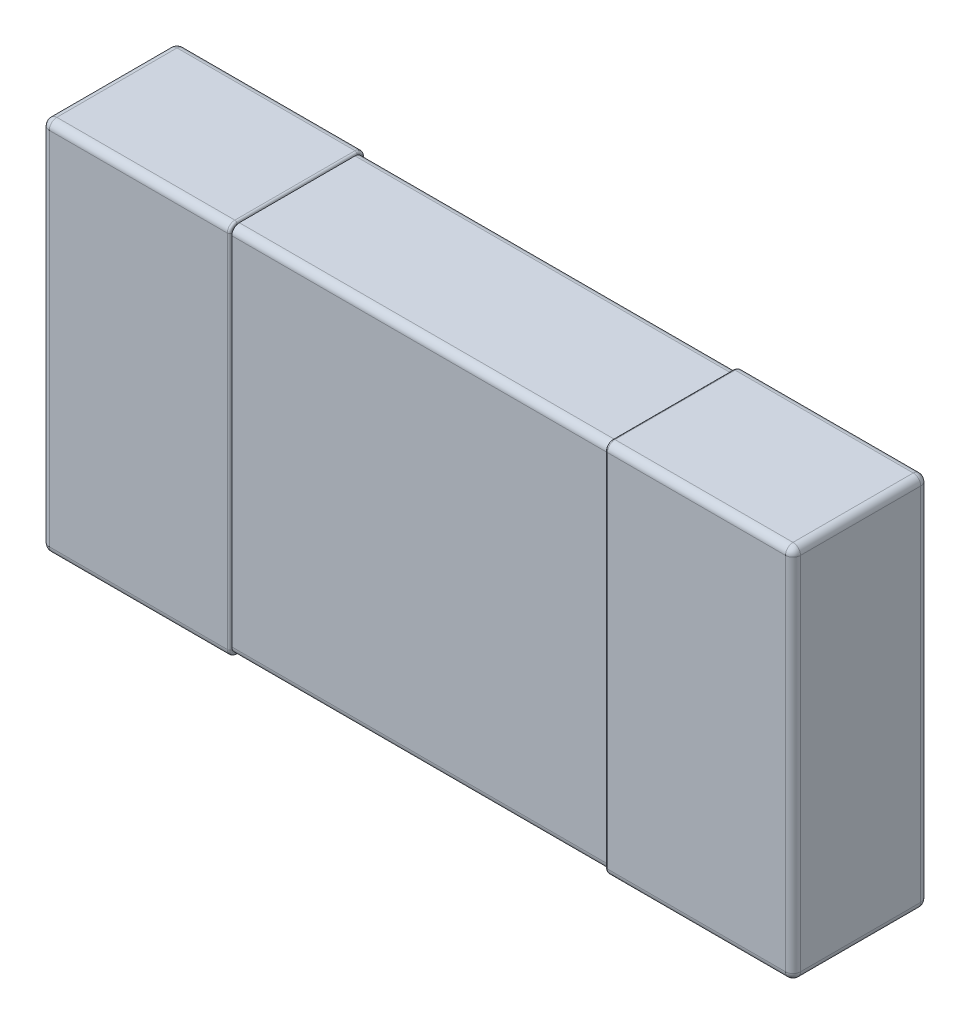
from build123d import *

# Parameters (mm, degrees)
SKETCH1_W                           = 1
SKETCH1_H                           = 0.5
ALL_BODY_DEPTH                      = 0.18
CUT_OUT_THE_BODY_FOR_PIN_DEPTH      = 0.25
CUT_OUT_THE_BODY_FOR_PIN_DEPTH_BACK = 0.25
SKETCH2_OUTSIDE_W                   = 2.406
SKETCH2_OUTSIDE_H                   = 2.726
SKETCH2_OUTSIDE_W_2                 = 0.174
SKETCH2_OUTSIDE_H_2                 = 0.494
BODY_FILLET_R                       = 0.01
PIN_FILLET_A_R                      = 0.01
PIN_FILLET_B_R                      = 0.003


with BuildPart() as part:
    # Sketch1 → All body (new body)
    with BuildSketch(Plane.XY):
        Rectangle(SKETCH1_W, SKETCH1_H)
    extrude(amount=ALL_BODY_DEPTH)

    # Sketch2 outside → Cut out the body for pin (cut, two sides: drawn at the far end of the back side and taken through both)
    with BuildSketch(Plane(origin=(0, 0, 0), x_dir=(0, 0, -1), z_dir=(1, 0, 0)).offset(-CUT_OUT_THE_BODY_FOR_PIN_DEPTH_BACK)):
        with Locations((-0.09, 0)):
            Rectangle(SKETCH2_OUTSIDE_W, SKETCH2_OUTSIDE_H)
        with Locations((-0.09, 0)):
            Rectangle(SKETCH2_OUTSIDE_W_2, SKETCH2_OUTSIDE_H_2, mode=Mode.SUBTRACT)
    extrude(amount=CUT_OUT_THE_BODY_FOR_PIN_DEPTH + CUT_OUT_THE_BODY_FOR_PIN_DEPTH_BACK, mode=Mode.SUBTRACT)

    # Body fillet
    body_fillet_edges = [part.edges().sort_by_distance(p)[0] for p in [
        (0, 0.247, 0.003),
        (0, 0.247, 0.177),
        (0, -0.247, 0.177),
        (0, -0.247, 0.003),
    ]]
    fillet(body_fillet_edges, radius=BODY_FILLET_R)

    # Pin fillet a
    pin_fillet_a_edges = [part.edges().sort_by_distance(p)[0] for p in [
        (0.5, 0, 0.18),
        (-0.375, 0.25, 0),
        (0.375, -0.25, 0),
        (0.375, -0.25, 0.18),
        (-0.375, 0.25, 0.18),
        (0.375, 0.25, 0.18),
        (-0.5, 0, 0.18),
        (0.375, 0.25, 0),
        (0.5, 0, 0),
        (-0.375, -0.25, 0),
        (-0.5, 0, 0),
        (-0.5, 0.25, 0.09),
        (0.5, 0.25, 0.09),
        (0.5, -0.25, 0.09),
        (-0.5, -0.25, 0.09),
        (-0.375, -0.25, 0.18),
    ]]
    fillet(pin_fillet_a_edges, radius=PIN_FILLET_A_R)

    # Pin fillet b
    pin_fillet_b_edges = [part.edges().sort_by_distance(p)[0] for p in [
        (0.25, -0.25, 0.09),
        (0.25, 0, 0.18),
        (0.25, 0.25, 0.09),
        (0.25, 0, 0),
        (-0.25, 0.25, 0.09),
        (-0.25, 0, 0.18),
        (-0.25, -0.25, 0.09),
        (-0.25, 0, 0),
        (0.25, 0.247071068, 0.002928932),
        (0.25, -0.247071068, 0.002928932),
        (0.25, -0.247071068, 0.177071068),
        (0.25, 0.247071068, 0.177071068),
        (-0.25, -0.247071068, 0.177071068),
        (-0.25, 0.247071068, 0.177071068),
        (-0.25, -0.247071068, 0.002928932),
        (-0.25, 0.247071068, 0.002928932),
    ]]
    fillet(pin_fillet_b_edges, radius=PIN_FILLET_B_R - 0.0001)  # a hair under: the kernel refuses the full size


solid = part.part
